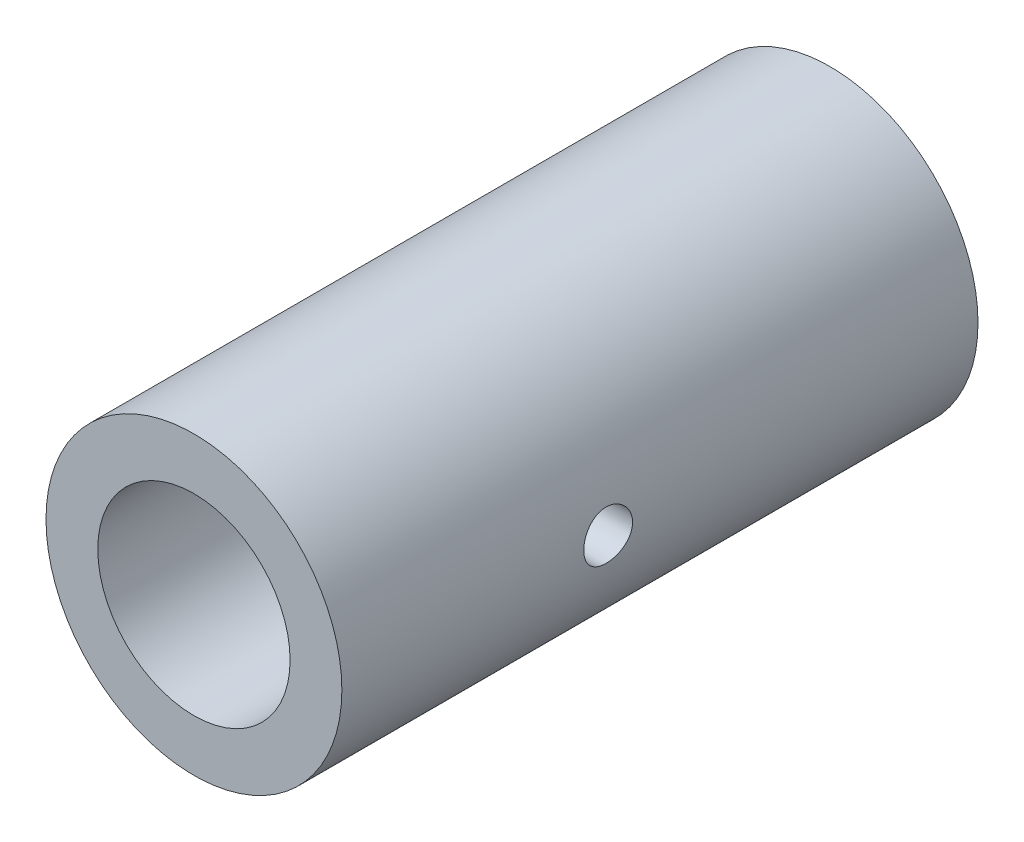
from build123d import *

# Parameters (mm, degrees)
SKETCH_1_R          = 10
EXTRUDE_1_DEPTH     = 43
SKETCH_2_R          = 6.5
CUT_EXTRUDE_1_DEPTH = 27
M4X0_71_D           = 3.3
M3X0_51_D           = 2.5
M3X0_51_DEPTH       = 8.5
M3X0_51_TIP         = 0.751075774


with BuildPart() as part:
    # Эскиз1 → Бобышка-Вытянуть1 (new body)
    with BuildSketch(Plane.XY):
        Circle(SKETCH_1_R)
    extrude(amount=EXTRUDE_1_DEPTH)

    # Эскиз2 → Вырез-Вытянуть1 (cut)
    with BuildSketch(Plane.XY.offset(43)):
        Circle(SKETCH_2_R)
    extrude(amount=-CUT_EXTRUDE_1_DEPTH, mode=Mode.SUBTRACT)

    # Отверстие обработанное метчиком M4x0.71 (through all)
    with Locations(Plane(origin=(-10, 0, 0), x_dir=(0, 0, -1), z_dir=(-1, 0, 0))):
        with Locations((-25, 0)):
            Hole(M4X0_71_D / 2)

    # Отверстие обработанное метчиком M3x0.51
    with Locations(Plane(origin=(0, 0, 0), x_dir=(-1, 0, 0), z_dir=(0, 0, -1))):
        with Locations((-4.242640687, 4.242640687), (4.242640687, 4.242640687), (4.242640687, -4.242640687), (-4.242640687, -4.242640687)):
            Hole(M3X0_51_D / 2, depth=M3X0_51_DEPTH)
            with Locations((0, 0, -(M3X0_51_DEPTH + M3X0_51_TIP / 2))):  # 118° drill point
                Cone(0, M3X0_51_D / 2, M3X0_51_TIP, mode=Mode.SUBTRACT)


solid = part.part
